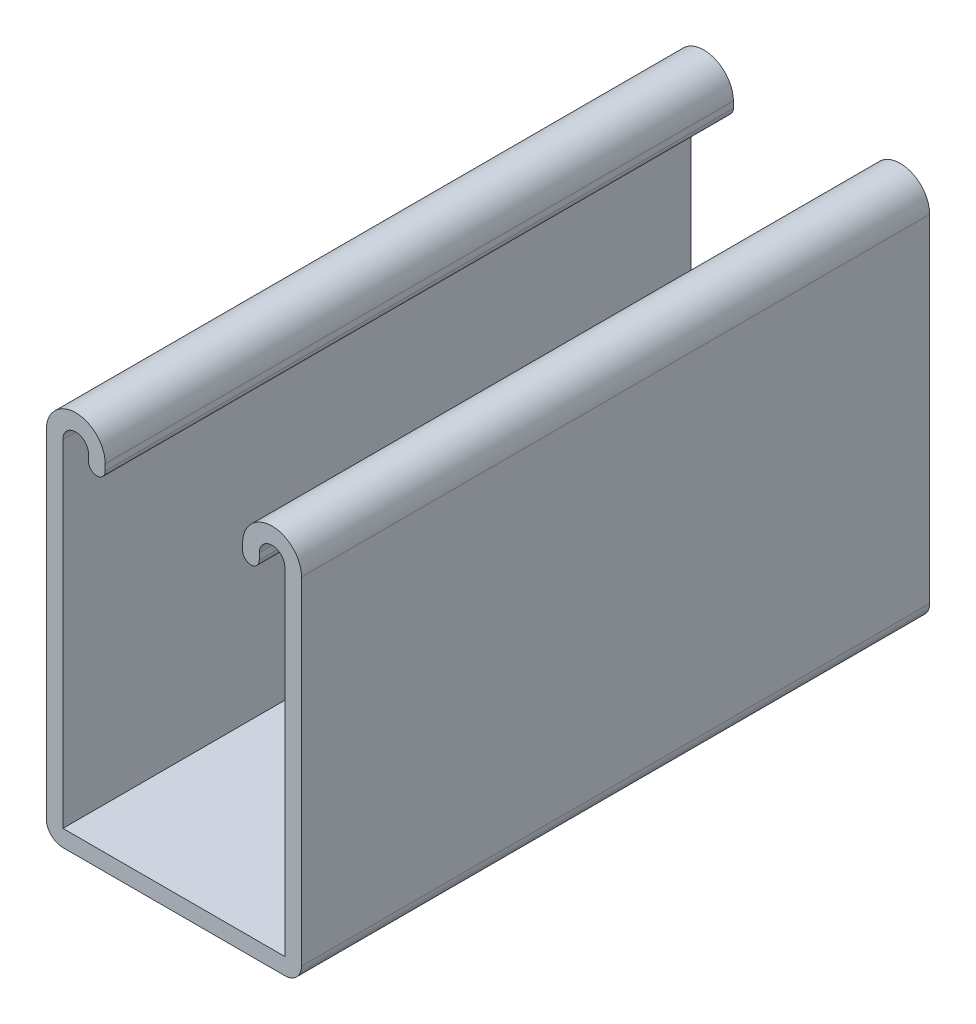
from build123d import *

# Parameters (mm, degrees)
BASE_EXTRUDE_DEPTH = 101.6
HOLE1_START        = -28.0162
HOLE1_OUTLINE_R    = 7.14375
HOLE1_DEPTH        = 2.6924
LPATTERN2_COUNT    = 2
LPATTERN2_PITCH    = 47.625


# Read off the part's stored shape, not the designer's step: Hole1
with BuildPart() as part:
    # Sketch1 → Base-Extrude (new body)
    with BuildSketch(Plane.XY):
        with BuildLine():
            Line((-20.6375, 29.1719), (-20.6375, -25.3238))
            ThreePointArc((-20.6375, -25.3238), (-19.848914298, -27.227614298), (-17.9451, -28.0162))
            Line((-17.9451, -28.0162), (17.9451, -28.0162))
            ThreePointArc((17.9451, -28.0162), (19.848914298, -27.227614298), (20.6375, -25.3238))
            Line((20.6375, -25.3238), (20.6375, 29.1719))
            ThreePointArc((20.6375, 29.1719), (15.875, 33.9344), (11.1125, 29.1719))
            Line((11.1125, 29.1719), (11.1125, 28.13685))
            ThreePointArc((11.1125, 28.13685), (12.4587, 26.79065), (13.8049, 28.13685))
            Line((13.8049, 28.13685), (13.8049, 29.1719))
            ThreePointArc((13.8049, 29.1719), (15.875, 31.242), (17.9451, 29.1719))
            Line((17.9451, 29.1719), (17.9451, -25.3238))
            Line((17.9451, -25.3238), (-17.9451, -25.3238))
            Line((-17.9451, -25.3238), (-17.9451, 29.1719))
            ThreePointArc((-17.9451, 29.1719), (-15.875, 31.242), (-13.8049, 29.1719))
            Line((-13.8049, 29.1719), (-13.8049, 28.13685))
            ThreePointArc((-13.8049, 28.13685), (-12.4587, 26.79065), (-11.1125, 28.13685))
            Line((-11.1125, 28.13685), (-11.1125, 29.1719))
            ThreePointArc((-11.1125, 29.1719), (-15.875, 33.9344), (-20.6375, 29.1719))
        make_face()
    extrude(amount=BASE_EXTRUDE_DEPTH)

    # Hole1 outline → Hole1 (cut)
    with BuildSketch(Plane(origin=(0, 0, 0), x_dir=(1, 0, 0), z_dir=(0, 1, 0)).offset(HOLE1_START)):
        with Locations((0, -23.8125)):
            Circle(HOLE1_OUTLINE_R)
    hole1 = extrude(amount=HOLE1_DEPTH, mode=Mode.SUBTRACT)

    # LPattern2: Hole1 ×2
    with Locations(*[(0, 0, i * LPATTERN2_PITCH) for i in range(1, LPATTERN2_COUNT)]):
        add(hole1, mode=Mode.SUBTRACT)


solid = part.part
